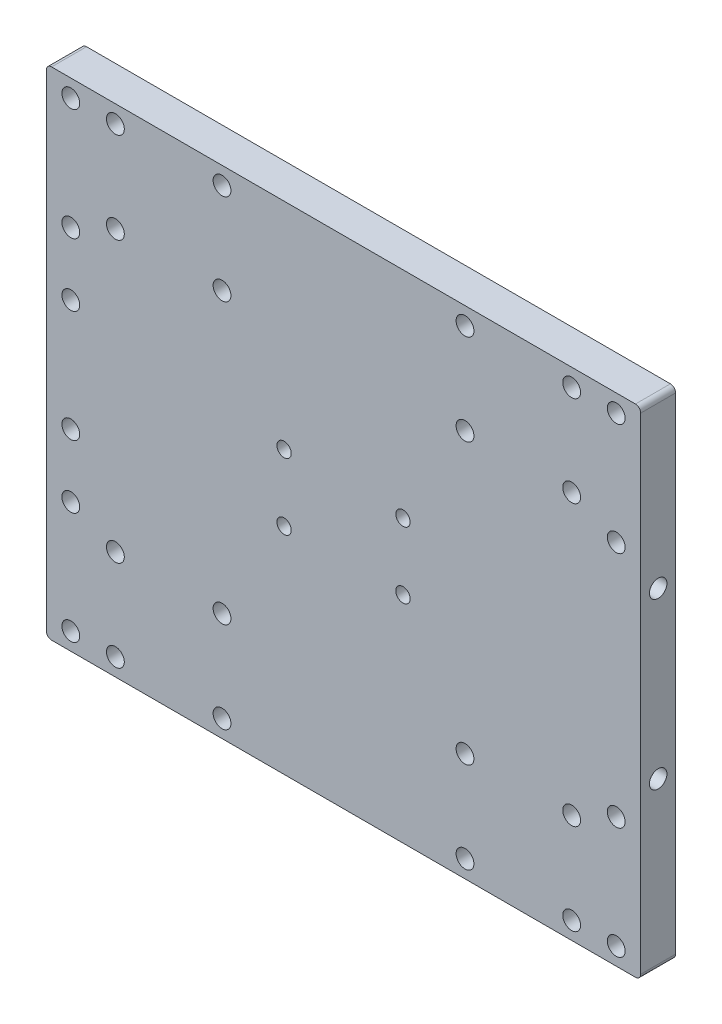
from build123d import *

# Parameters (mm, degrees)
SKETCH1_W           = 170
SKETCH1_H           = 142
BOSS_EXTRUDE1_DEPTH = 5
SKETCH2_R           = 2.55
CUT_EXTRUDE1_DEPTH  = 112.202517957
SKETCH3_R           = 2.55
CUT_EXTRUDE2_DEPTH  = 112.202517957
SKETCH4_R           = 2.05
CUT_EXTRUDE3_DEPTH  = 112.202517957
SKETCH5_R           = 2.5
CUT_EXTRUDE4_DEPTH  = 10
SKETCH6_R           = 2.55
CUT_EXTRUDE5_DEPTH  = 112.202517957
FILLET1_R           = 1.5


with BuildPart() as part:
    # Sketch1 → Boss-Extrude1 (new, symmetric)
    with BuildSketch(Plane.XY):
        Rectangle(SKETCH1_W, SKETCH1_H)
    extrude(amount=BOSS_EXTRUDE1_DEPTH, both=True)

    # Sketch2 → Cut-Extrude1 (cut, through all)
    with BuildSketch(Plane.XY.offset(5)):
        with Locations((-65.25, 66)):
            Circle(SKETCH2_R)
        with Locations((-34.75, 66)):
            Circle(SKETCH2_R)
        with Locations((-34.75, 40)):
            Circle(SKETCH2_R)
        with Locations((-65.25, 40)):
            Circle(SKETCH2_R)
        with Locations((65.25, 66)):
            Circle(SKETCH2_R)
        with Locations((65.25, 40)):
            Circle(SKETCH2_R)
        with Locations((34.75, 40)):
            Circle(SKETCH2_R)
        with Locations((34.75, 66)):
            Circle(SKETCH2_R)
        with Locations((-65.25, -40)):
            Circle(SKETCH2_R)
        with Locations((-34.75, -40)):
            Circle(SKETCH2_R)
        with Locations((-34.75, -66)):
            Circle(SKETCH2_R)
        with Locations((-65.25, -66)):
            Circle(SKETCH2_R)
        with Locations((34.75, -40)):
            Circle(SKETCH2_R)
        with Locations((65.25, -40)):
            Circle(SKETCH2_R)
        with Locations((65.25, -66)):
            Circle(SKETCH2_R)
        with Locations((34.75, -66)):
            Circle(SKETCH2_R)
    extrude(amount=-CUT_EXTRUDE1_DEPTH, mode=Mode.SUBTRACT)

    # Sketch3 → Cut-Extrude2 (cut, through all)
    with BuildSketch(Plane.XY.offset(5)):
        with Locations((-78, 66)):
            Circle(SKETCH3_R)
        with Locations((-78, 34)):
            Circle(SKETCH3_R)
        with Locations((-78, -34)):
            Circle(SKETCH3_R)
        with Locations((-78, -66)):
            Circle(SKETCH3_R)
        with Locations((78, 66)):
            Circle(SKETCH3_R)
        with Locations((78, 34)):
            Circle(SKETCH3_R)
        with Locations((78, -34)):
            Circle(SKETCH3_R)
        with Locations((78, -66)):
            Circle(SKETCH3_R)
    extrude(amount=-CUT_EXTRUDE2_DEPTH, mode=Mode.SUBTRACT)

    # Sketch4 → Cut-Extrude3 (cut, through all)
    with BuildSketch(Plane.XY.offset(5)):
        with Locations((-17, 9.5)):
            Circle(SKETCH4_R)
        with Locations((-17, -9.5)):
            Circle(SKETCH4_R)
        with Locations((17, -9.5)):
            Circle(SKETCH4_R)
        with Locations((17, 9.5)):
            Circle(SKETCH4_R)
    extrude(amount=-CUT_EXTRUDE3_DEPTH, mode=Mode.SUBTRACT)

    # Sketch5 → Cut-Extrude4 (cut)
    with BuildSketch(Plane(origin=(85, 0, 0), x_dir=(0, 0, -1), z_dir=(1, 0, 0))):
        with Locations((0, 23.6)):
            Circle(SKETCH5_R)
        with Locations((0, -23.6)):
            Circle(SKETCH5_R)
    extrude(amount=-CUT_EXTRUDE4_DEPTH, mode=Mode.SUBTRACT)

    # Sketch6 → Cut-Extrude5 (cut, through all)
    with BuildSketch(Plane.XY.offset(5)):
        with Locations((-78, 16)):
            Circle(SKETCH6_R)
        with Locations((-78, -16)):
            Circle(SKETCH6_R)
    extrude(amount=-CUT_EXTRUDE5_DEPTH, mode=Mode.SUBTRACT)

    # Fillet1
    fillet1_edges = [part.edges().sort_by_distance(p)[0] for p in [
        (-85, -71, 0),
        (85, -71, 0),
        (85, 71, 0),
        (-85, 71, 0),
    ]]
    fillet(fillet1_edges, radius=FILLET1_R)


solid = part.part
